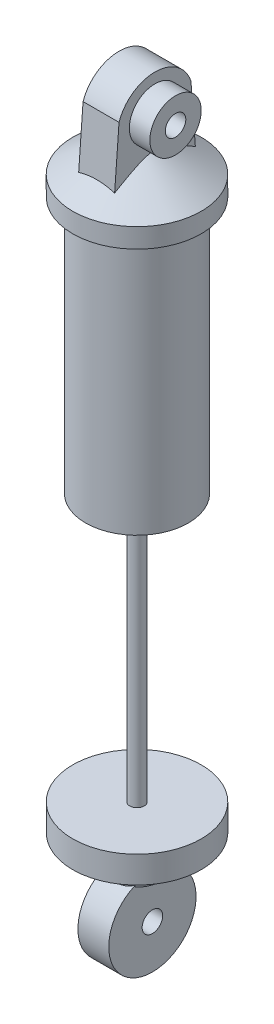
from build123d import *

# Parameters (mm, degrees)
SKETCH1_R      = 7.9375
EXTRUDE1_DEPTH = 70.485
SKETCH4_R      = 1.27
EXTRUDE2_DEPTH = 2.2225
SKETCH5_R      = 5.3975
SKETCH5_R_2    = 1.27
EXTRUDE3_DEPTH = 1.905
SKETCH6_R      = 4.1275
EXTRUDE4_DEPTH = 1.905
SKETCH7_R      = 2.8575
EXTRUDE5_DEPTH = 1.905
SKETCH8_R      = 3.175
SKETCH8_R_2    = 1.27
EXTRUDE6_DEPTH = 2.54
SKETCH9_R      = 7.9375
SKETCH9_R_2    = 6.35
EXTRUDE7_DEPTH = 33.02
SKETCH10_R     = 8.451029387
SKETCH10_R_2   = 0.889
EXTRUDE8_DEPTH = 33.02


with BuildPart() as part:
    # Sketch1 → Extrude1 (new body)
    with BuildSketch(Plane(origin=(0, 0, 0), x_dir=(1, 0, 0), z_dir=(0, 1, 0))):
        with Locations(Location((0, 0, 0), (0, 0, 270))):
            Circle(SKETCH1_R)
    extrude(amount=-EXTRUDE1_DEPTH)

    # Loft1: read off the stored shape, not the designer's step
    # Loft1: loft between two sections, ruled curve by curve
    loft1_from = [
        Edge.make_bspline([(3.207196431, 0, 7.26070226), (17.72860095, 0, 0.846309398), (11.314208088, 0, -13.675095122), (-3.207196431, 0, -7.26070226), (-17.72860095, 0, -0.846309398), (-11.314208088, 0, 13.675095122), (3.207196431, 0, 7.26070226)], [0, 0, 0, 0, 0.5, 0.5, 0.5, 1, 1, 1, 1], 3, [1, 0.333333333, 0.333333333, 1, 0.333333333, 0.333333333, 1]),
    ]
    loft1_to = [
        Edge.make_bspline([(0.075387957, 3.937, 1.903507724), (3.882403406, 3.937, 1.75273181), (3.731627491, 3.937, -2.054283639), (-0.075387957, 3.937, -1.903507724), (-3.882403406, 3.937, -1.75273181), (-3.731627491, 3.937, 2.054283639), (0.075387957, 3.937, 1.903507724)], [0, 0, 0, 0, 0.5, 0.5, 0.5, 1, 1, 1, 1], 3, [1, 0.333333333, 0.333333333, 1, 0.333333333, 0.333333333, 1]),
    ]
    loft1 = Solid(Shell([*[Face.make_surface_from_curves(loft1_from[k], loft1_to[k]) for k in range(1)], Face(Wire(loft1_from)), Face(Wire(loft1_to))]))
    add(loft1)

    # Sketch4 → Extrude2 (add, symmetric)
    with BuildSketch(Plane(origin=(0, 0, 0), x_dir=(0, 0, -1), z_dir=(1, 0, 0))):
        with BuildLine():
            Line((4.965601833, 1.905), (4.445, 8.89))
            ThreePointArc((4.445, 8.89), (0, 12.065), (-4.445, 8.89))
            Line((-4.445, 8.89), (-4.965601949, 1.905))
            Line((-4.965601949, 1.905), (-5.107584298, 0))
            Line((-5.107584298, 0), (5.107584151, 0))
            Line((5.107584151, 0), (4.965601833, 1.905))
        make_face()
        with Locations((0, 7.62)):
            Circle(SKETCH4_R, mode=Mode.SUBTRACT)
    extrude(amount=EXTRUDE2_DEPTH, both=True)

    # Sketch6 → Extrude4 (add)
    with BuildSketch(Plane.XZ.offset(70.485)):
        with Locations(Location((0, 0, 0), (0, 0, 90))):
            Circle(SKETCH6_R)
    extrude(amount=EXTRUDE4_DEPTH)



with BuildPart() as body_2:
    # Sketch5 → Extrude3 (new, symmetric)
    with BuildSketch(Plane(origin=(0, 0, 0), x_dir=(0, 0, -1), z_dir=(1, 0, 0))):
        with Locations(Location((0, -79.0575, 0), (0, 0, 180))):
            Circle(SKETCH5_R)
        with Locations(Location((0, -79.0575, 0), (0, 0, 180))):
            Circle(SKETCH5_R_2, mode=Mode.SUBTRACT)
    extrude(amount=EXTRUDE3_DEPTH, both=True)


with BuildPart() as part_1:
    add(part.part)

    add(body_2.part)  # Extrude5 merges body 2
    # Sketch7 → Extrude5 (add)
    with BuildSketch(Plane.XZ.offset(72.39)):
        with Locations(Location((0, 0, 0), (0, 0, 117.266044451))):
            Circle(SKETCH7_R)
    extrude(amount=EXTRUDE5_DEPTH)

    # Sketch8 → Extrude6 (add)
    with BuildSketch(Plane(origin=(2.2225, 0, 0), x_dir=(0, 0, -1), z_dir=(1, 0, 0))):
        with Locations(Location((0, 7.62, 0), (0, 0, 180))):
            Circle(SKETCH8_R)
        with Locations((0, 7.62)):
            Circle(SKETCH8_R_2, mode=Mode.SUBTRACT)
    extrude(amount=EXTRUDE6_DEPTH)

    # Sketch9 → Extrude7 (cut)
    with BuildSketch(Plane(origin=(0, -2.413, 0), x_dir=(-1, 0, 0), z_dir=(0, 1, 0))):
        with Locations(Location((0, 0, 0), (0, 0, 90))):
            Circle(SKETCH9_R)
        with Locations(Location((0, 0, 0), (0, 0, 90))):
            Circle(SKETCH9_R_2, mode=Mode.SUBTRACT)
    extrude(amount=-EXTRUDE7_DEPTH, mode=Mode.SUBTRACT)

    # Sketch10 → Extrude8 (cut)
    with BuildSketch(Plane(origin=(0, -34.163, 0), x_dir=(-1, 0, 0), z_dir=(0, 1, 0))):
        Circle(SKETCH10_R)
        with Locations(Location((0, 0, 0), (0, 0, 90))):
            Circle(SKETCH10_R_2, mode=Mode.SUBTRACT)
    extrude(amount=-EXTRUDE8_DEPTH, mode=Mode.SUBTRACT)


solid = part_1.part
